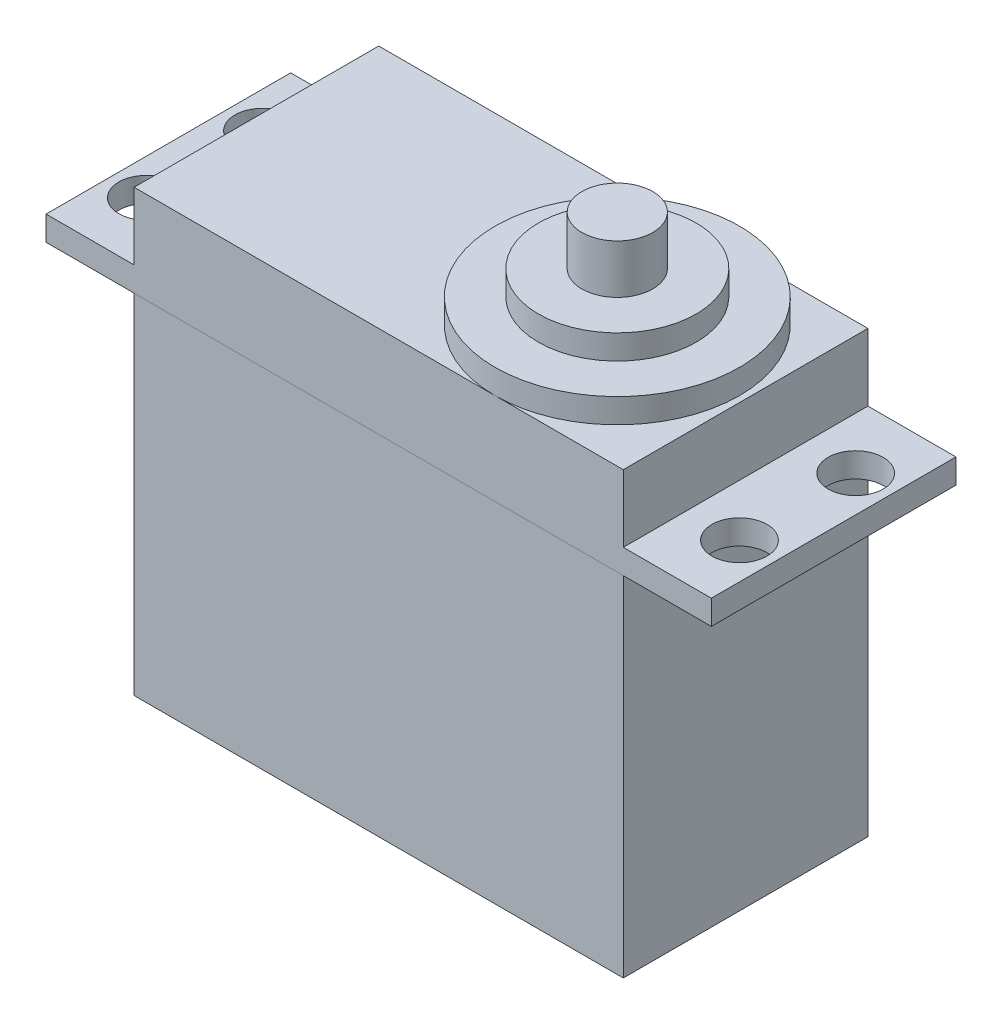
from build123d import *

# Parameters (mm, degrees)
CROQUIS1_W              = 40
CROQUIS1_H              = 20
SALIENTE_EXTRUIR1_DEPTH = 28.5
SALIENTE_EXTRUIR2_DEPTH = 2
CROQUIS3_R              = 2.25
CORTAR_EXTRUIR1_DEPTH   = 2.1
SALIENTE_EXTRUIR3_DEPTH = 5.5
CROQUIS5_R              = 10.001656383
SALIENTE_EXTRUIR4_DEPTH = 2
CROQUIS6_R              = 6.45
SALIENTE_EXTRUIR5_DEPTH = 2
CROQUIS7_R              = 2.9
SALIENTE_EXTRUIR6_DEPTH = 4


with BuildPart() as part:
    # Croquis1 → Saliente-Extruir1 (new body)
    with BuildSketch(Plane(origin=(0, 0, 0), x_dir=(1, 0, 0), z_dir=(0, 1, 0))):
        with Locations((20, -10)):
            Rectangle(CROQUIS1_W, CROQUIS1_H)
    extrude(amount=SALIENTE_EXTRUIR1_DEPTH)

    # Croquis2 → Saliente-Extruir2 (add)
    with BuildSketch(Plane(origin=(0, 28.5, 0), x_dir=(1, 0, 0), z_dir=(0, 1, 0))):
        Polygon((20, 0), (-7.2, 0), (-7.2, -20.003312767), (47.2, -20.003312767), (47.2, 0), align=None)
    extrude(amount=SALIENTE_EXTRUIR2_DEPTH)

    # Croquis3 → Cortar-Extruir1 (cut)
    with BuildSketch(Plane(origin=(0, 30.5, 0), x_dir=(1, 0, 0), z_dir=(0, 1, 0))):
        with Locations((-4.25, -5.251656383)):
            Circle(CROQUIS3_R)
        with Locations((-4.25, -14.751656383)):
            Circle(CROQUIS3_R)
        with Locations((44.25, -5.251656383)):
            Circle(CROQUIS3_R)
        with Locations((44.25, -14.751656383)):
            Circle(CROQUIS3_R)
    extrude(amount=-CORTAR_EXTRUIR1_DEPTH, mode=Mode.SUBTRACT)

    # Croquis4 → Saliente-Extruir3 (add)
    with BuildSketch(Plane(origin=(0, 30.5, 0), x_dir=(1, 0, 0), z_dir=(0, 1, 0))):
        Polygon((0, 0), (0, -20.003312767), (40.001626581, -20.003312767), (40, 0), align=None)
    extrude(amount=SALIENTE_EXTRUIR3_DEPTH)

    # Croquis5 → Saliente-Extruir4 (add)
    with BuildSketch(Plane(origin=(0, 36, 0), x_dir=(1, 0, 0), z_dir=(0, 1, 0))):
        with Locations((29.510368289, -10.001656383)):
            Circle(CROQUIS5_R)
    extrude(amount=SALIENTE_EXTRUIR4_DEPTH)

    # Croquis6 → Saliente-Extruir5 (add)
    with BuildSketch(Plane(origin=(0, 38, 0), x_dir=(1, 0, 0), z_dir=(0, 1, 0))):
        with Locations((29.510368289, -10.001656383)):
            Circle(CROQUIS6_R)
    extrude(amount=SALIENTE_EXTRUIR5_DEPTH)

    # Croquis7 → Saliente-Extruir6 (add)
    with BuildSketch(Plane(origin=(0, 40, 0), x_dir=(1, 0, 0), z_dir=(0, 1, 0))):
        with Locations((29.510368289, -10.001656383)):
            Circle(CROQUIS7_R)
    extrude(amount=SALIENTE_EXTRUIR6_DEPTH)


solid = part.part
